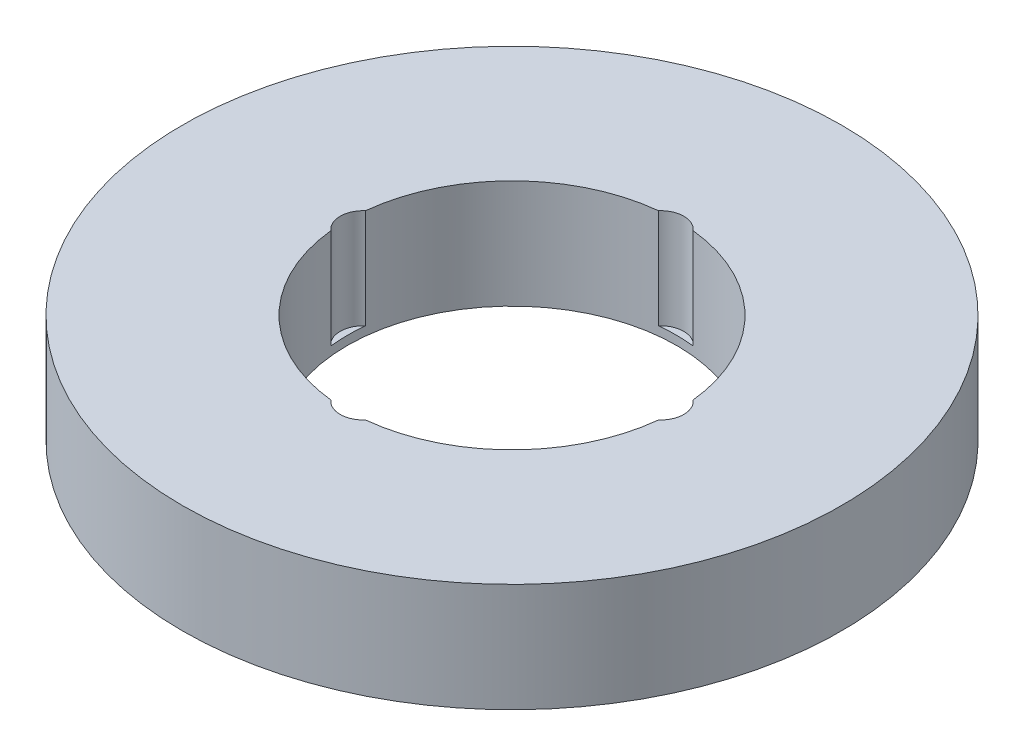
from build123d import *

# Parameters (mm, degrees)
SKETCH1_R           = 85
BOSS_EXTRUDE1_DEPTH = 28
SKETCH2_R           = 42.5
CUT_EXTRUDE1_DEPTH  = 124.426091245
SKETCH3_R           = 5.93712615
CUT_EXTRUDE2_DEPTH  = 25.722541296
CIRPATTERN1_COUNT   = 4


with BuildPart() as part:
    # Sketch1 → Boss-Extrude1 (new body)
    with BuildSketch(Plane(origin=(0, 0, 0), x_dir=(1, 0, 0), z_dir=(0, 1, 0))):
        Circle(SKETCH1_R)
    extrude(amount=BOSS_EXTRUDE1_DEPTH)

    # Sketch2 → Cut-Extrude1 (cut, through all)
    with BuildSketch(Plane(origin=(0, 0, 0), x_dir=(1, 0, 0), z_dir=(0, 1, 0))):
        Circle(SKETCH2_R)
    extrude(amount=CUT_EXTRUDE1_DEPTH, mode=Mode.SUBTRACT)

    # Sketch3 → Cut-Extrude2 (cut)
    with BuildSketch(Plane(origin=(0, 28, 0), x_dir=(1, 0, 0), z_dir=(0, 1, 0))):
        with Locations((-38.361960231, 0)):
            Circle(SKETCH3_R)
    cut_extrude2 = extrude(amount=-CUT_EXTRUDE2_DEPTH, mode=Mode.SUBTRACT)

    # CirPattern1: Cut-Extrude2 ×4 about axis
    cirpattern1_axis = Axis((0, 0, 0), (0, 1, 0))
    for i in range(1, CIRPATTERN1_COUNT):
        add(cut_extrude2.rotate(cirpattern1_axis, i * 360 / CIRPATTERN1_COUNT), mode=Mode.SUBTRACT)


solid = part.part
